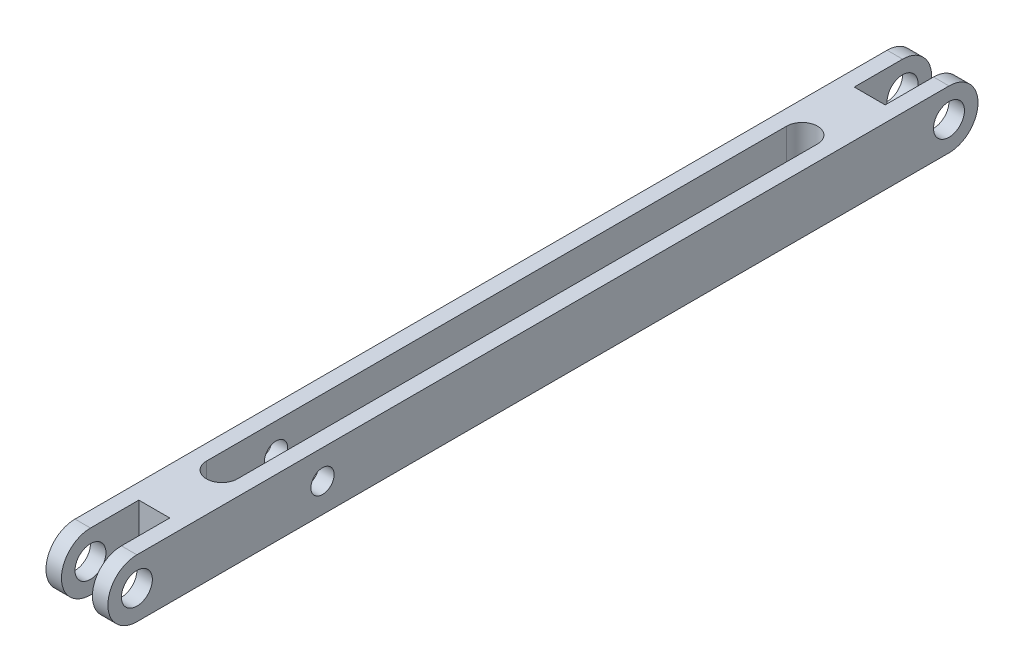
from build123d import *

# Parameters (mm, degrees)
EXTRUDE_1_DEPTH     = 16
SKETCH_3_W          = 8
SKETCH_3_H          = 20
CUT_EXTRUDE_1_DEPTH = 115.617843288
SKETCH_4_R          = 4
CUT_EXTRUDE_2_DEPTH = 114.879322091
CUT_EXTRUDE_3_DEPTH = 115.617843288
SKETCH_6_R          = 3
CUT_EXTRUDE_4_DEPTH = 114.879322091


with BuildPart() as part:
    # 草图2 → 凸台-拉伸1 (new body)
    with BuildSketch(Plane(origin=(0, 0, 0), x_dir=(0, 0, -1), z_dir=(1, 0, 0))):
        with BuildLine():
            Line((-105, -7.5), (105, -7.5))
            ThreePointArc((105, -7.5), (112.5, 0), (105, 7.5))
            Line((105, 7.5), (-105, 7.5))
            ThreePointArc((-105, 7.5), (-112.5, 0), (-105, -7.5))
        make_face()
    extrude(amount=EXTRUDE_1_DEPTH)

    # 草图3 → 切除-拉伸1 (cut, through all)
    with BuildSketch(Plane(origin=(0, 7.5, 0), x_dir=(1, 0, 0), z_dir=(0, 1, 0))):
        with Locations((8, -102.5)):
            Rectangle(SKETCH_3_W, SKETCH_3_H)
        with Locations((8, 102.5)):
            Rectangle(SKETCH_3_W, SKETCH_3_H)
    extrude(amount=-CUT_EXTRUDE_1_DEPTH, mode=Mode.SUBTRACT)

    # 草图4 → 切除-拉伸2 (cut, through all)
    with BuildSketch(Plane(origin=(16, 0, 0), x_dir=(0, 0, -1), z_dir=(1, 0, 0))):
        with Locations((-105, 0)):
            Circle(SKETCH_4_R)
        with Locations((105, 0)):
            Circle(SKETCH_4_R)
    extrude(amount=-CUT_EXTRUDE_2_DEPTH, mode=Mode.SUBTRACT)

    # 草图5 → 切除-拉伸3 (cut, through all)
    with BuildSketch(Plane.XZ.offset(7.5)):
        with BuildLine():
            Line((12, 75), (12, -75))
            ThreePointArc((12, -75), (8, -79), (4, -75))
            Line((4, -75), (4, 75))
            ThreePointArc((4, 75), (8, 79), (12, 75))
        make_face()
    extrude(amount=-CUT_EXTRUDE_3_DEPTH, mode=Mode.SUBTRACT)

    # 草图6 → 切除-拉伸4 (cut, through all)
    with BuildSketch(Plane.ZY):
        with Locations((57, 0)):
            Circle(SKETCH_6_R)
    extrude(amount=-CUT_EXTRUDE_4_DEPTH, mode=Mode.SUBTRACT)


solid = part.part
